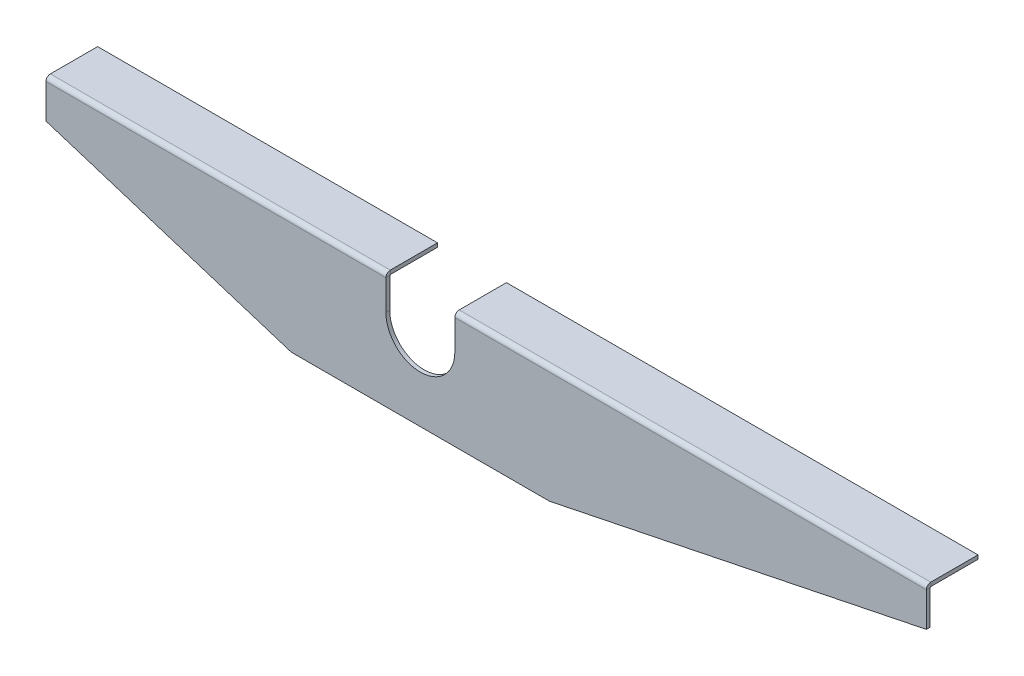
from build123d import *

# Parameters (mm, degrees)
BASE_FLANGE1_DEPTH             = 1.5
EDGE_FLANGE1_STRIP_W           = 6.4
EDGE_FLANGE1_STRIP_H           = 1.5
EDGE_FLANGE1_STRIP_CUT_DEPTH   = 131.65
EDGE_FLANGE1_STRIP_2_W         = 6.4
EDGE_FLANGE1_STRIP_2_H         = 1.5
EDGE_FLANGE1_STRIP_CUT_2_DEPTH = 182.65
EDGE_FLANGE1_DEPTH             = 131.65
EDGE_FLANGE1_BEND_DEPTH        = 182.65


# Sheet-metal steps are written as plain solids
with BuildPart() as part:
    # Sketch1 → Base-Flange1 (new body)
    with BuildSketch(Plane.XY):
        with BuildLine():
            Line((13.35, 0), (13.35, 13.35))
            Line((13.35, 13.35), (196, 13.35))
            Line((196, 13.35), (196, -1.65))
            Line((196, -1.65), (50, -31.65))
            Line((50, -31.65), (-50, -31.65))
            Line((-50, -31.65), (-145, -1.65))
            Line((-145, -1.65), (-145, 13.35))
            Line((-145, 13.35), (-13.35, 13.35))
            Line((-13.35, 13.35), (-13.35, 0))
            ThreePointArc((-13.35, 0), (0, -13.35), (13.35, 0))
        make_face()
    extrude(amount=-BASE_FLANGE1_DEPTH)

    # Edge-Flange1 strip (across the edge) → Edge-Flange1 strip cut (cut)
    with BuildSketch(Plane(origin=(-145, 13.35, -1.5), x_dir=(0, -1, 0), z_dir=(1, 0, 0))):
        with Locations((-1.5, -0.75)):
            Rectangle(EDGE_FLANGE1_STRIP_W, EDGE_FLANGE1_STRIP_H)
    extrude(amount=EDGE_FLANGE1_STRIP_CUT_DEPTH, mode=Mode.SUBTRACT)

    # Edge-Flange1 strip 2 (across the edge) → Edge-Flange1 strip cut 2 (cut)
    with BuildSketch(Plane(origin=(13.35, 13.35, -1.5), x_dir=(0, -1, 0), z_dir=(1, 0, 0))):
        with Locations((-1.5, -0.75)):
            Rectangle(EDGE_FLANGE1_STRIP_2_W, EDGE_FLANGE1_STRIP_2_H)
    extrude(amount=EDGE_FLANGE1_STRIP_CUT_2_DEPTH, mode=Mode.SUBTRACT)

    # Edge-Flange1 section (across the edge) → Edge-Flange1 (add)
    with BuildSketch(Plane(origin=(-145, 13.35, -1.5), x_dir=(0, -1, 0), z_dir=(1, 0, 0))):
        with BuildLine():
            Line((0, 0.2), (0, 18.5))
            Line((0, 18.5), (1.5, 18.5))
            Line((1.5, 18.5), (1.5, 0.2))
            ThreePointArc((1.5, 0.2), (1.558578644, 0.058578644), (1.7, 0))
            Line((1.7, 0), (1.7, -1.5))
            ThreePointArc((1.7, -1.5), (0.497918472, -1.002081528), (0, 0.2))
        make_face()
    extrude(amount=EDGE_FLANGE1_DEPTH)

    # Edge-Flange1 section 2 (across the edge) → Edge-Flange1 bend (add)
    with BuildSketch(Plane(origin=(13.35, 13.35, -1.5), x_dir=(0, -1, 0), z_dir=(1, 0, 0))):
        with BuildLine():
            Line((0, 0.2), (0, 18.5))
            Line((0, 18.5), (1.5, 18.5))
            Line((1.5, 18.5), (1.5, 0.2))
            ThreePointArc((1.5, 0.2), (1.558578644, 0.058578644), (1.7, 0))
            Line((1.7, 0), (1.7, -1.5))
            ThreePointArc((1.7, -1.5), (0.497918472, -1.002081528), (0, 0.2))
        make_face()
    extrude(amount=EDGE_FLANGE1_BEND_DEPTH)


solid = part.part
